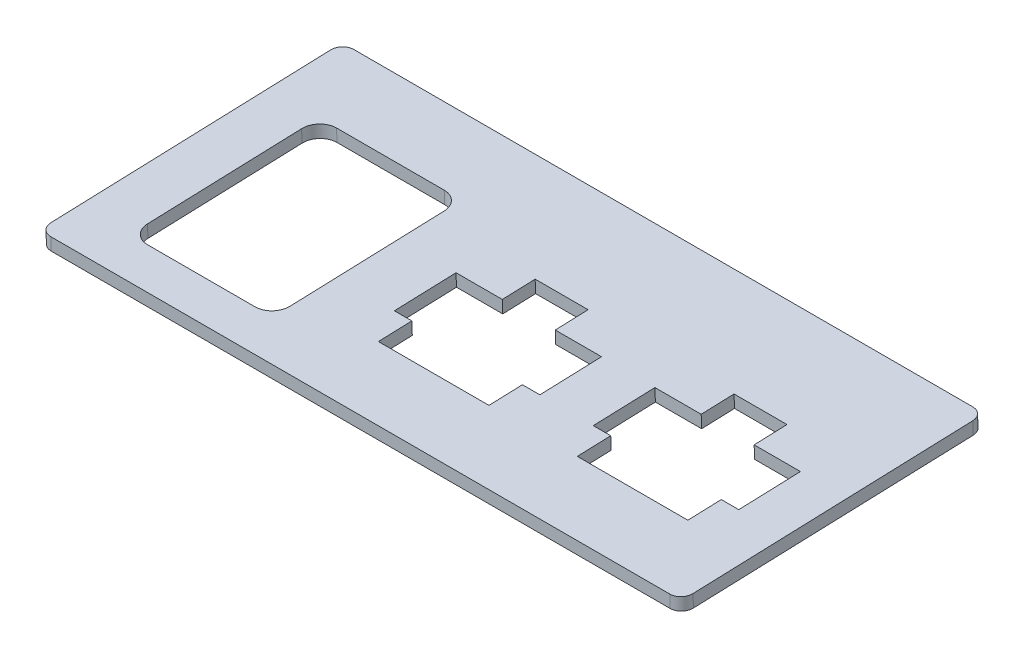
from build123d import *

# Parameters (mm, degrees)
SKETCH1_W           = 110.35
SKETCH1_H           = 52.101351528
BOSS_EXTRUDE1_DEPTH = 2.2
CUT_EXTRUDE1_REACH  = 75.143
FILLET1_R           = 2


with BuildPart() as part:
    # Sketch1 → Boss-Extrude1 (new body)
    with BuildSketch(Plane(origin=(0, -71.98718802, -2.513847999), x_dir=(1, 0, 0), z_dir=(0, 0.9993908270190958, 0.03489949670250105))):
        with Locations((0, 21.839080484)):
            Rectangle(SKETCH1_W, SKETCH1_H)
    extrude(amount=BOSS_EXTRUDE1_DEPTH)

    # Sketch2 → Cut-Extrude1 (cut, up to next)
    with BuildSketch(Plane(origin=(0, -71.98718802, -2.513847999), x_dir=(1, 0, 0), z_dir=(0, -0.9993908270190958, -0.03489949670250106)), mode=Mode.PRIVATE) as cut_extrude1_sk1:
        Polygon((-4.05, -24.262096542), (-4.05, -29.912096542), (5.05, -29.912096542), (5.05, -24.262096542), (13, -24.262096542), (13, -13.662096542), (10, -13.662096542), (10, -7.912096542), (-9, -7.912096542), (-9, -13.662096542), (-12, -13.662096542), (-12, -24.262096542), align=None)
    cut_extrude1_tool1 = extrude(cut_extrude1_sk1.sketch, amount=-CUT_EXTRUDE1_REACH, mode=Mode.PRIVATE) & part.part
    # Sketch2 → Cut-Extrude1 (cut, up to next)
    with BuildSketch(Plane(origin=(0, -71.98718802, -2.513847999), x_dir=(1, 0, 0), z_dir=(0, -0.9993908270190958, -0.03489949670250106)), mode=Mode.PRIVATE) as cut_extrude1_sk2:
        with BuildLine():
            Line((-43.425, -2.662096542), (-24.925, -2.662096542))
            ThreePointArc((-24.925, -2.662096542), (-22.803679656, -3.540776198), (-21.925, -5.662096542))
            Line((-21.925, -5.662096542), (-21.925, -32.162096542))
            ThreePointArc((-21.925, -32.162096542), (-22.803679656, -34.283416885), (-24.925, -35.162096542))
            Line((-24.925, -35.162096542), (-43.425, -35.162096542))
            ThreePointArc((-43.425, -35.162096542), (-45.546320344, -34.283416885), (-46.425, -32.162096542))
            Line((-46.425, -32.162096542), (-46.425, -5.662096542))
            ThreePointArc((-46.425, -5.662096542), (-45.546320344, -3.540776198), (-43.425, -2.662096542))
        make_face()
    cut_extrude1_tool2 = extrude(cut_extrude1_sk2.sketch, amount=-CUT_EXTRUDE1_REACH, mode=Mode.PRIVATE) & part.part
    # Sketch2 → Cut-Extrude1 (cut, up to next)
    with BuildSketch(Plane(origin=(0, -71.98718802, -2.513847999), x_dir=(1, 0, 0), z_dir=(0, -0.9993908270190958, -0.03489949670250106)), mode=Mode.PRIVATE) as cut_extrude1_sk3:
        Polygon((30.125, -24.262096542), (22.175, -24.262096542), (22.175, -13.662096542), (25.175, -13.662096542), (25.175, -7.912096542), (44.175, -7.912096542), (44.175, -13.662096542), (47.175, -13.662096542), (47.175, -24.262096542), (39.225, -24.262096542), (39.225, -29.912096542), (30.125, -29.912096542), align=None)
    cut_extrude1_tool3 = extrude(cut_extrude1_sk3.sketch, amount=-CUT_EXTRUDE1_REACH, mode=Mode.PRIVATE) & part.part
    add(cut_extrude1_tool1.solids().sort_by_distance((0.5, -71.364395, -20.348299))[0], mode=Mode.SUBTRACT)
    add(cut_extrude1_tool2.solids().sort_by_distance((-34.175, -71.327165, -21.414424))[0], mode=Mode.SUBTRACT)
    add(cut_extrude1_tool3.solids().sort_by_distance((34.675, -71.364395, -20.348299))[0], mode=Mode.SUBTRACT)

    # Fillet1
    fillet1_edges = [part.edges().sort_by_distance(p)[0] for p in [
        (-55.175, -71.034840666, 1.733571137),
        (55.175, -71.034840666, 1.733571137),
        (55.175, -69.21652972, -50.336041655),
        (-55.175, -69.21652972, -50.336041655),
    ]]
    fillet(fillet1_edges, radius=FILLET1_R)


solid = part.part
